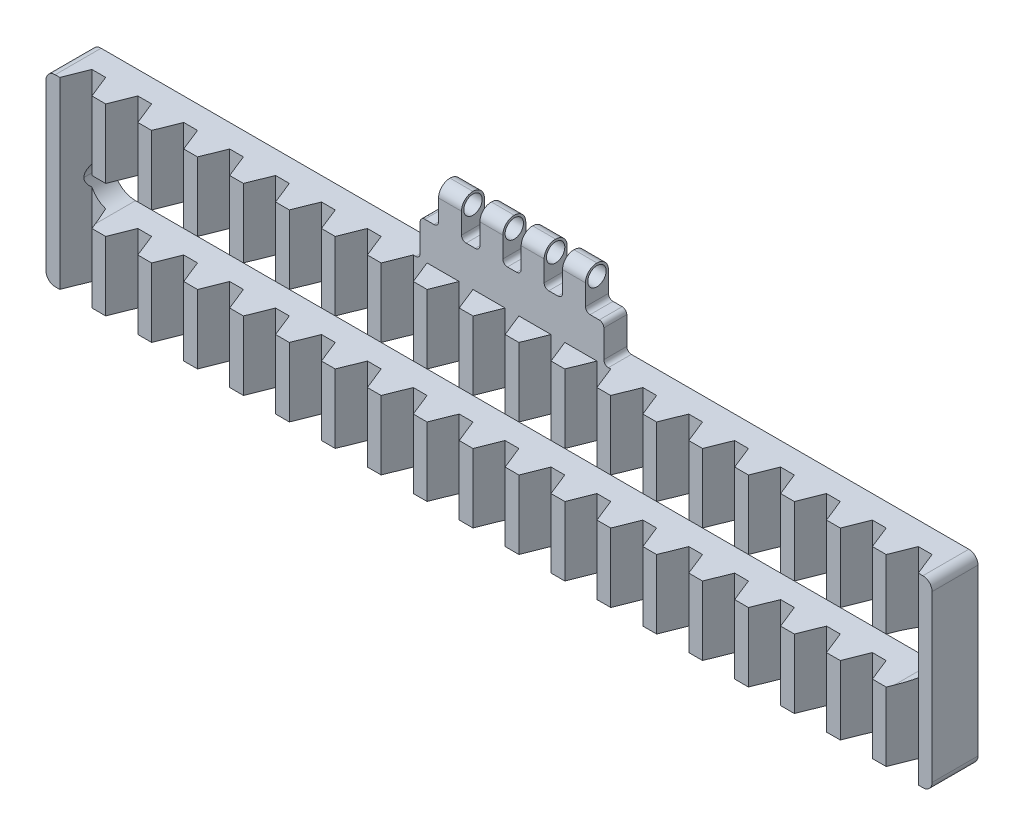
from build123d import *

# Parameters (mm, degrees)
SKETCH1_W               = 193
SKETCH1_H               = 10
BOSS_EXTRUDE1_DEPTH     = 40
CUT_EXTRUDE1_DEPTH      = 44
SKETCH3_W               = 184
SKETCH3_H               = 10
CUT_EXTRUDE2_DEPTH      = 22
FILLET1_R               = 5
SKETCH4_W               = 184
SKETCH4_H               = 5
CUT_EXTRUDE3_DEPTH      = 4
FILLET3_R               = 2
SKETCH4_4_W             = 184
SKETCH4_4_H             = 1.5
CUT_EXTRUDE4_DEPTH      = 2
FILLET4_R               = 2.5
FILLET5_R               = 4
SKETCH5_W               = 40
SKETCH5_H               = 5
BOSS_EXTRUDE2_DEPTH     = 8
SKETCH6_W               = 5
SKETCH6_H               = 5
BOSS_EXTRUDE3_DEPTH     = 8
FILLET6_R               = 2.5
LPATTERN1_COUNT         = 4
LPATTERN1_PITCH         = 9
FILLET6_OF_LPATTERN1_R  = 2.5
CUT_EXTRUDE5_DEPTH      = 126.766648997
CUT_EXTRUDE5_DEPTH_BACK = 126.766648997
SKETCH7_R               = 2
FILLET7_R               = 1


with BuildPart() as part:
    # Sketch1 → Boss-Extrude1 (new body)
    with BuildSketch(Plane(origin=(0, 0, 0), x_dir=(1, 0, 0), z_dir=(0, 1, 0))):
        Rectangle(SKETCH1_W, SKETCH1_H)
    extrude(amount=BOSS_EXTRUDE1_DEPTH)

    # Sketch2 → Cut-Extrude1 (cut)
    with BuildSketch(Plane(origin=(0, 0, 0), x_dir=(1, 0, 0), z_dir=(0, 1, 0))):
        Polygon((-96.5, -5), (-93.5, -5), (-91.5, 0), (-88.5, 0), (-86.5, -5), (-83.5, -5), (-81.5, 0), (-78.5, 0), (-76.5, -5), (-73.5, -5), (-71.5, 0), (-68.5, 0), (-66.5, -5), (-63.5, -5), (-61.5, 0), (-58.5, 0), (-56.5, -5), (-53.5, -5), (-51.5, 0), (-48.5, 0), (-46.5, -5), (-43.5, -5), (-41.5, 0), (-38.5, 0), (-36.5, -5), (-33.5, -5), (-31.5, 0), (-28.5, 0), (-26.5, -5), (-23.5, -5), (-21.5, 0), (-18.5, 0), (-16.5, -5), (-13.5, -5), (-11.5, 0), (-8.5, 0), (-6.5, -5), (-3.5, -5), (-1.5, 0), (1.5, 0), (3.5, -5), (6.5, -5), (8.5, 0), (11.5, 0), (13.5, -5), (16.5, -5), (18.5, 0), (21.5, 0), (23.5, -5), (26.5, -5), (28.5, 0), (31.5, 0), (33.5, -5), (36.5, -5), (38.5, 0), (41.5, 0), (43.5, -5), (46.5, -5), (48.5, 0), (51.5, 0), (53.5, -5), (56.5, -5), (58.5, 0), (61.5, 0), (63.5, -5), (66.5, -5), (68.5, 0), (71.5, 0), (73.5, -5), (76.5, -5), (78.5, 0), (81.5, 0), (83.5, -5), (86.5, -5), (88.5, 0), (91.5, 0), (93.5, -5), (96.5, -5), (96.5, -20.768022812), (-96.5, -20.768022812), align=None)
    extrude(amount=CUT_EXTRUDE1_DEPTH, mode=Mode.SUBTRACT)

    # Sketch3 → Cut-Extrude2 (cut, symmetric)
    with BuildSketch(Plane.XY):
        with Locations((0, 20)):
            Rectangle(SKETCH3_W, SKETCH3_H)
    extrude(amount=CUT_EXTRUDE2_DEPTH, both=True, mode=Mode.SUBTRACT)

    # Fillet1
    fillet1_edges = [part.edges().sort_by_distance(p)[0] for p in [
        (92, 15, -1.875),
        (92, 25, -1.875),
        (-92, 15, -1.875),
        (-92, 25, -1.875),
    ]]
    fillet(fillet1_edges, radius=FILLET1_R - 0.0001)  # a hair under: the kernel refuses the full size

    # Sketch4 → Cut-Extrude3 (cut)
    with BuildSketch(Plane.XY.offset(-5)):
        with Locations((0, 32.5)):
            Rectangle(SKETCH4_W, SKETCH4_H)
        with Locations((0, 7.5)):
            Rectangle(SKETCH4_W, SKETCH4_H)
    extrude(amount=CUT_EXTRUDE3_DEPTH, mode=Mode.SUBTRACT)

    # Fillet3
    fillet3_edges = [part.edges().sort_by_distance(p)[0] for p in [
        (96.5, 40, 0),
        (-96.5, 40, 0),
        (96.5, 0, 0),
        (-96.5, 0, 0),
    ]]
    fillet(fillet3_edges, radius=FILLET3_R)

    # Sketch4<4> → Cut-Extrude4 (cut)
    with BuildSketch(Plane.XY.offset(-5)):
        with Locations((0, 35.75)):
            Rectangle(SKETCH4_4_W, SKETCH4_4_H)
        with Locations((0, 29.25)):
            Rectangle(SKETCH4_4_W, SKETCH4_4_H)
        with Locations((0, 10.75)):
            Rectangle(SKETCH4_4_W, SKETCH4_4_H)
        with Locations((0, 4.25)):
            Rectangle(SKETCH4_4_W, SKETCH4_4_H)
    extrude(amount=CUT_EXTRUDE4_DEPTH, mode=Mode.SUBTRACT)

    # Fillet4
    fillet4_edges = [part.edges().sort_by_distance(p)[0] for p in [
        (92, 35, -2),
        (92, 30, -2),
        (-92, 35, -2),
        (-92, 30, -2),
        (-92, 10, -2),
        (-92, 5, -2),
        (92, 10, -2),
        (92, 5, -2),
    ]]
    fillet(fillet4_edges, radius=FILLET4_R - 0.0001)  # a hair under: the kernel refuses the full size

    # Fillet5
    fillet5_edges = [part.edges().sort_by_distance(p)[0] for p in [
        (-92, 3.5, -4),
        (-92, 11.5, -4),
        (-92, 28.5, -4),
        (-92, 36.5, -4),
        (92, 11.5, -4),
        (92, 3.5, -4),
        (92, 28.5, -4),
        (92, 36.5, -4),
    ]]
    fillet(fillet5_edges, radius=FILLET5_R - 0.0001)  # a hair under: the kernel refuses the full size

    # Sketch5 → Boss-Extrude2 (add)
    with BuildSketch(Plane(origin=(0, 40, 0), x_dir=(1, 0, 0), z_dir=(0, 1, 0))):
        with Locations((0, 2.5)):
            Rectangle(SKETCH5_W, SKETCH5_H)
    extrude(amount=BOSS_EXTRUDE2_DEPTH)

    # Sketch6 → Boss-Extrude3 (add)
    with BuildSketch(Plane(origin=(0, 48, 0), x_dir=(1, 0, 0), z_dir=(0, 1, 0))):
        with Locations((-13.5, 2.5)):
            Rectangle(SKETCH6_W, SKETCH6_H)
    boss_extrude3 = extrude(amount=BOSS_EXTRUDE3_DEPTH)

    # Fillet6
    fillet6_edges = [part.edges().sort_by_distance(p)[0] for p in [
        (-13.5, 56, -5),
        (-13.5, 56, 0),
    ]]
    fillet(fillet6_edges, radius=FILLET6_R - 0.0001)  # a hair under: the kernel refuses the full size

    # LPattern1: Boss-Extrude3 ×4
    with Locations(*[(i * LPATTERN1_PITCH, 0, 0) for i in range(1, LPATTERN1_COUNT)]):
        add(boss_extrude3)

    # Fillet6 of LPattern1
    fillet6_of_lpattern1_edges = [part.edges().sort_by_distance(p)[0] for p in [
        (-4.5, 56, -5),
        (-4.5, 56, 0),
        (4.5, 56, -5),
        (4.5, 56, 0),
        (13.5, 56, -5),
        (13.5, 56, 0),
    ]]
    fillet(fillet6_of_lpattern1_edges, radius=FILLET6_OF_LPATTERN1_R - 0.0001)  # a hair under: the kernel refuses the full size

    # Sketch7 → Cut-Extrude5 (cut, two sides: drawn at the far end of the back side and taken through both)
    with BuildSketch(Plane.ZY.offset(16).offset(-CUT_EXTRUDE5_DEPTH_BACK)):
        with Locations((-2.5, 53.5)):
            Circle(SKETCH7_R)
    extrude(amount=CUT_EXTRUDE5_DEPTH + CUT_EXTRUDE5_DEPTH_BACK, mode=Mode.SUBTRACT)

    # Fillet7
    fillet7_edges = [part.edges().sort_by_distance(p)[0] for p in [
        (11, 48, -2.5),
        (16, 48, -2.5),
        (-20, 40, -2.5),
        (20, 40, -2.5),
        (-20, 48, -2.5),
        (20, 48, -2.5),
        (-16, 48, -2.5),
        (-11, 48, -2.5),
        (-7, 48, -2.5),
        (-2, 48, -2.5),
        (2, 48, -2.5),
        (7, 48, -2.5),
    ]]
    fillet(fillet7_edges, radius=FILLET7_R)


solid = part.part
